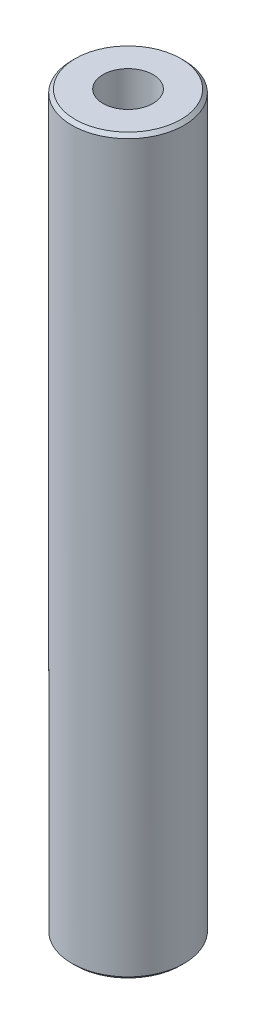
from build123d import *

# Parameters (mm, degrees)
SKETCH1_R           = 12.5
BOSS_EXTRUDE1_DEPTH = 163.12171841
SKETCH2_R           = 5.574403872
CUT_EXTRUDE1_DEPTH  = 165.076796096
CHAMFER1_SIZE       = 0.743838961


with BuildPart() as part:
    # Sketch1 → Boss-Extrude1 (new body)
    with BuildSketch(Plane(origin=(0, 0, 0), x_dir=(1, 0, 0), z_dir=(0, 1, 0))):
        Circle(SKETCH1_R)
    extrude(amount=BOSS_EXTRUDE1_DEPTH)

    # Sketch2 → Cut-Extrude1 (cut, through all)
    with BuildSketch(Plane(origin=(0, 0, 0), x_dir=(1, 0, 0), z_dir=(0, 1, 0))):
        Circle(SKETCH2_R)
    extrude(amount=CUT_EXTRUDE1_DEPTH, mode=Mode.SUBTRACT)

    # Chamfer1
    chamfer1_edges = [part.edges().sort_by_distance(p)[0] for p in [
        (-12.5, 163.12171841, 0),
        (-12.5, 0, 0),
    ]]
    chamfer(chamfer1_edges, length=CHAMFER1_SIZE)


solid = part.part
